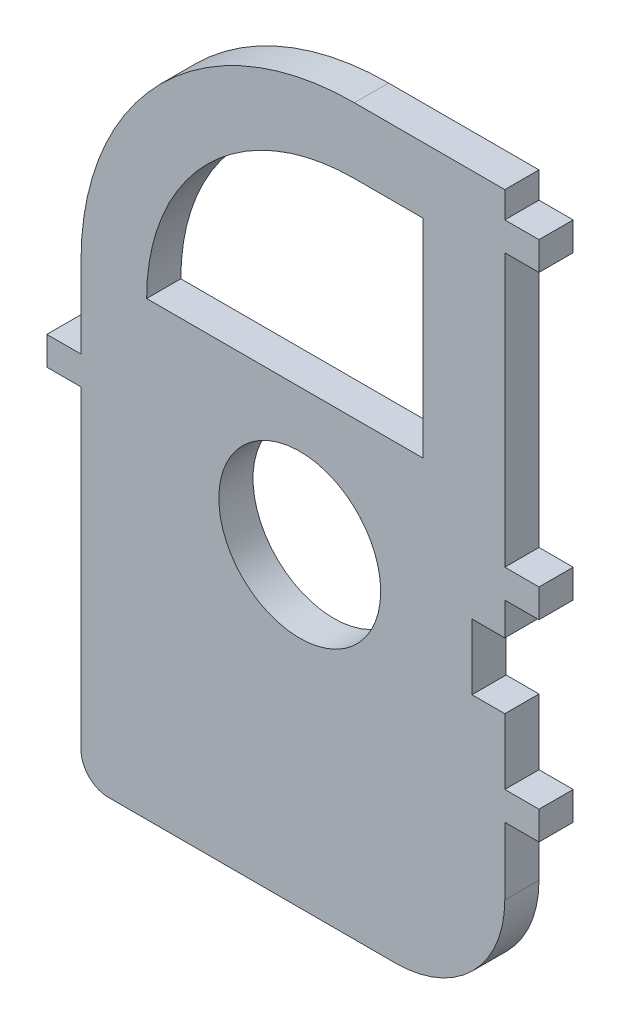
from build123d import *

# Parameters (mm, degrees)
SKETCH1_R              = 3.7592
BOSS_EXTRUDE1_DEPTH    = 1.5875
FILLET1_R              = 5.08
FILLET2_R              = 1.27
WEIGHT_REDUCTION_REACH = 24.437


with BuildPart() as part:
    # Sketch1 → Boss-Extrude1 (new body)
    with BuildSketch(Plane.XY):
        with BuildLine():
            Line((11.1125, 17.8308), (9.525, 17.8308))
            Line((9.525, 17.8308), (9.525, 19.05))
            Line((9.525, 19.05), (2.54, 19.05))
            ThreePointArc((2.54, 19.05), (-6.440256121, 15.330256121), (-10.16, 6.35))
            Line((-10.16, 6.35), (-10.16, 2.5908))
            Line((-10.16, 2.5908), (-11.7475, 2.5908))
            Line((-11.7475, 2.5908), (-11.7475, 1.27))
            Line((-11.7475, 1.27), (-10.16, 1.27))
            Line((-10.16, 1.27), (-10.16, -14.605))
            Line((-10.16, -14.605), (9.525, -14.605))
            Line((9.525, -14.605), (9.525, -6.4008))
            Line((9.525, -6.4008), (11.1125, -6.4008))
            Line((11.1125, -6.4008), (11.1125, -5.08))
            Line((11.1125, -5.08), (9.525, -5.08))
            Line((9.525, -5.08), (9.525, -2.032))
            Line((9.525, -2.032), (8.001, -2.032))
            Line((8.001, -2.032), (8.001, 1.016))
            Line((8.001, 1.016), (9.525, 1.016))
            Line((9.525, 1.016), (9.525, 2.54))
            Line((9.525, 2.54), (11.1125, 2.54))
            Line((11.1125, 2.54), (11.1125, 3.8608))
            Line((11.1125, 3.8608), (9.525, 3.8608))
            Line((9.525, 3.8608), (9.525, 16.51))
            Line((9.525, 16.51), (11.1125, 16.51))
            Line((11.1125, 16.51), (11.1125, 17.8308))
        make_face()
        Circle(SKETCH1_R, mode=Mode.SUBTRACT)
    extrude(amount=BOSS_EXTRUDE1_DEPTH)

    # Fillet1
    fillet1_edges = [part.edges().sort_by_distance(p)[0] for p in [
        (9.525, -14.605, 0.79375),
    ]]
    fillet(fillet1_edges, radius=FILLET1_R)

    # Fillet2
    fillet2_edges = [part.edges().sort_by_distance(p)[0] for p in [
        (-10.16, -14.605, 0.79375),
    ]]
    fillet(fillet2_edges, radius=FILLET2_R)

    # Sketch2 → Weight Reduction (cut, up to next)
    with BuildSketch(Plane.XY.offset(1.5875), mode=Mode.PRIVATE) as weight_reduction_sk1:
        with BuildLine():
            Line((-7.112, 6.35), (5.715, 6.35))
            Line((5.715, 6.35), (5.715, 16.002))
            Line((5.715, 16.002), (2.54, 16.002))
            ThreePointArc((2.54, 16.002), (-4.284994652, 13.174994652), (-7.112, 6.35))
        make_face()
    weight_reduction_tool1 = extrude(weight_reduction_sk1.sketch, amount=-WEIGHT_REDUCTION_REACH, mode=Mode.PRIVATE) & part.part
    add(weight_reduction_tool1.solids().sort_by_distance((0.121424, 10.661798, 1.5875))[0], mode=Mode.SUBTRACT)


solid = part.part
